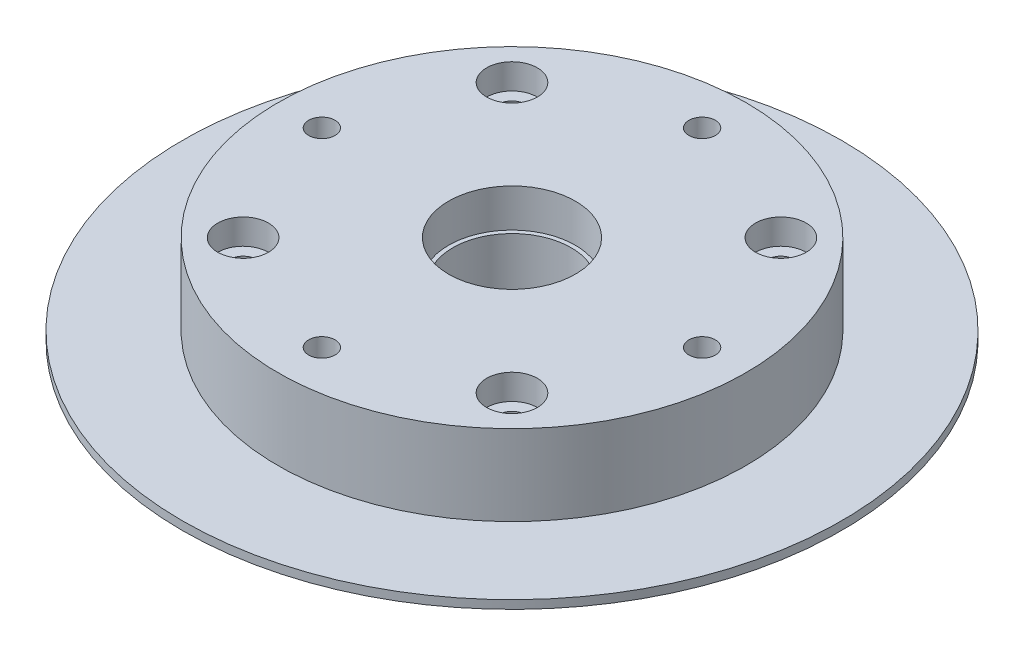
from build123d import *

# Parameters (mm, degrees)
SKETCH1_R           = 39
SKETCH1_R_2         = 1.5635
SKETCH1_R_3         = 7.5
BOSS_EXTRUDE1_DEPTH = 1
BOSS_EXTRUDE2_START = 9.525
SKETCH1_3_R         = 27.69
SKETCH1_3_R_2       = 1.5635
SKETCH1_3_R_3       = 7.5
BOSS_EXTRUDE2_DEPTH = 9.525
SKETCH2_R           = 3
SKETCH2_R_2         = 1.5635
CUT_EXTRUDE1_DEPTH  = 3
SKETCH1_4_R         = 7.5
SKETCH1_4_R_2       = 7
BOSS_EXTRUDE3_DEPTH = 1
BOSS_EXTRUDE4_START = 5
SKETCH1_5_R         = 7.5
SKETCH1_5_R_2       = 7
BOSS_EXTRUDE4_DEPTH = 5
SKETCH3_R           = 1.925
CUT_EXTRUDE2_DEPTH  = 4


with BuildPart() as part:
    # Sketch1 → Boss-Extrude1 (new body)
    with BuildSketch(Plane(origin=(0, 0, 0), x_dir=(1, 0, 0), z_dir=(0, 1, 0))):
        Circle(SKETCH1_R)
        with Locations((22.5, 0)):
            Circle(SKETCH1_R_2, mode=Mode.SUBTRACT)
        with Locations((-15.909902577, -15.909902577)):
            Circle(SKETCH1_R_2, mode=Mode.SUBTRACT)
        with Locations((0, -22.5)):
            Circle(SKETCH1_R_2, mode=Mode.SUBTRACT)
        with Locations((15.909902577, -15.909902577)):
            Circle(SKETCH1_R_2, mode=Mode.SUBTRACT)
        with Locations((-22.5, 0)):
            Circle(SKETCH1_R_2, mode=Mode.SUBTRACT)
        with Locations((-15.909902577, 15.909902577)):
            Circle(SKETCH1_R_2, mode=Mode.SUBTRACT)
        with Locations((0, 22.5)):
            Circle(SKETCH1_R_2, mode=Mode.SUBTRACT)
        Circle(SKETCH1_R_3, mode=Mode.SUBTRACT)
        with Locations((15.909902577, 15.909902577)):
            Circle(SKETCH1_R_2, mode=Mode.SUBTRACT)
    extrude(amount=-BOSS_EXTRUDE1_DEPTH)

    # Sketch1<3> → Boss-Extrude2 (add)
    with BuildSketch(Plane(origin=(0, 0, 0), x_dir=(1, 0, 0), z_dir=(0, 1, 0)).offset(BOSS_EXTRUDE2_START)):
        Circle(SKETCH1_3_R)
        with Locations((-15.909902577, -15.909902577)):
            Circle(SKETCH1_3_R_2, mode=Mode.SUBTRACT)
        with Locations((0, -22.5)):
            Circle(SKETCH1_3_R_2, mode=Mode.SUBTRACT)
        with Locations((15.909902577, -15.909902577)):
            Circle(SKETCH1_3_R_2, mode=Mode.SUBTRACT)
        with Locations((-22.5, 0)):
            Circle(SKETCH1_3_R_2, mode=Mode.SUBTRACT)
        with Locations((-15.909902577, 15.909902577)):
            Circle(SKETCH1_3_R_2, mode=Mode.SUBTRACT)
        with Locations((0, 22.5)):
            Circle(SKETCH1_3_R_2, mode=Mode.SUBTRACT)
        Circle(SKETCH1_3_R_3, mode=Mode.SUBTRACT)
        with Locations((15.909902577, 15.909902577)):
            Circle(SKETCH1_3_R_2, mode=Mode.SUBTRACT)
        with Locations((22.5, 0)):
            Circle(SKETCH1_3_R_2, mode=Mode.SUBTRACT)
    extrude(amount=-BOSS_EXTRUDE2_DEPTH)

    # Sketch2 → Cut-Extrude1 (cut)
    # profile 1 of 4: a face of its own
    with BuildSketch(Plane(origin=(0, 9.525, 0), x_dir=(1, 0, 0), z_dir=(0, 1, 0))):
        with Locations((15.909902577, 15.909902577)):
            Circle(SKETCH2_R)
        with Locations((15.909902577, 15.909902577)):
            Circle(SKETCH2_R_2, mode=Mode.SUBTRACT)
    # profile 2 of 4: a face of its own
    with BuildSketch(Plane(origin=(0, 9.525, 0), x_dir=(1, 0, 0), z_dir=(0, 1, 0))):
        with Locations((15.909902577, -15.909902577)):
            Circle(SKETCH2_R)
    # profile 3 of 4: a face of its own
    with BuildSketch(Plane(origin=(0, 9.525, 0), x_dir=(1, 0, 0), z_dir=(0, 1, 0))):
        with Locations((-15.909902577, -15.909902577)):
            Circle(SKETCH2_R)
        with Locations((-15.909902577, -15.909902577)):
            Circle(SKETCH2_R_2, mode=Mode.SUBTRACT)
    # profile 4 of 4: a face of its own
    with BuildSketch(Plane(origin=(0, 9.525, 0), x_dir=(1, 0, 0), z_dir=(0, 1, 0))):
        with Locations((-15.909902577, 15.909902577)):
            Circle(SKETCH2_R)
        with Locations((-15.909902577, 15.909902577)):
            Circle(SKETCH2_R_2, mode=Mode.SUBTRACT)
    extrude(amount=-CUT_EXTRUDE1_DEPTH, mode=Mode.SUBTRACT)

    # Sketch1<4> → Boss-Extrude3 (add)
    with BuildSketch(Plane(origin=(0, 0, 0), x_dir=(1, 0, 0), z_dir=(0, 1, 0))):
        Circle(SKETCH1_4_R)
        Circle(SKETCH1_4_R_2, mode=Mode.SUBTRACT)
    extrude(amount=-BOSS_EXTRUDE3_DEPTH)

    # Sketch1<5> → Boss-Extrude4 (add)
    with BuildSketch(Plane(origin=(0, 0, 0), x_dir=(1, 0, 0), z_dir=(0, 1, 0)).offset(BOSS_EXTRUDE4_START)):
        Circle(SKETCH1_5_R)
        Circle(SKETCH1_5_R_2, mode=Mode.SUBTRACT)
    extrude(amount=-BOSS_EXTRUDE4_DEPTH)

    # Sketch3 → Cut-Extrude2 (cut)
    with BuildSketch(Plane.XZ.offset(1)):
        with Locations((22.5, 0)):
            Circle(SKETCH3_R)
        with Locations((0, -22.5)):
            Circle(SKETCH3_R)
        with Locations((-22.5, 0)):
            Circle(SKETCH3_R)
        with Locations((0, 22.5)):
            Circle(SKETCH3_R)
    extrude(amount=-CUT_EXTRUDE2_DEPTH, mode=Mode.SUBTRACT)


solid = part.part
